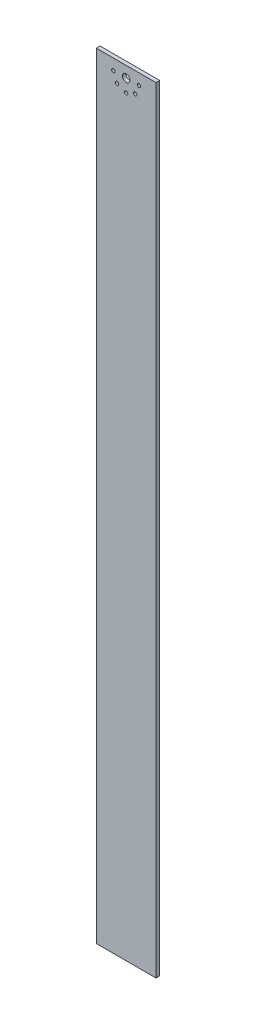
from build123d import *

# Parameters (mm, degrees)
SKETCH1_W                   = 50.8
SKETCH1_H                   = 660.4
BOSS_EXTRUDE1_DEPTH         = 3.175
M2_5_CLEARANCE_HOLE1_D      = 2.9
F_1_4_0_25_DIAMETER_HOLE1_D = 6.35


with BuildPart() as part:
    # Sketch1 → Boss-Extrude1 (new body)
    with BuildSketch(Plane.XY):
        Rectangle(SKETCH1_W, SKETCH1_H)
    extrude(amount=BOSS_EXTRUDE1_DEPTH)

    # M2.5 Clearance Hole1 (through all)
    with Locations(Plane.XY.offset(3.175)):
        with Locations((-11, 320.85), (-7.778174593, 313.071825407), (0, 309.85), (7.778174593, 313.071825407), (11, 320.85)):
            Hole(M2_5_CLEARANCE_HOLE1_D / 2)

    # 1/4 (0.25) Diameter Hole1 (through all)
    with Locations(Plane.XY.offset(3.175)):
        with Locations((0, 320.85)):
            Hole(F_1_4_0_25_DIAMETER_HOLE1_D / 2)


solid = part.part
